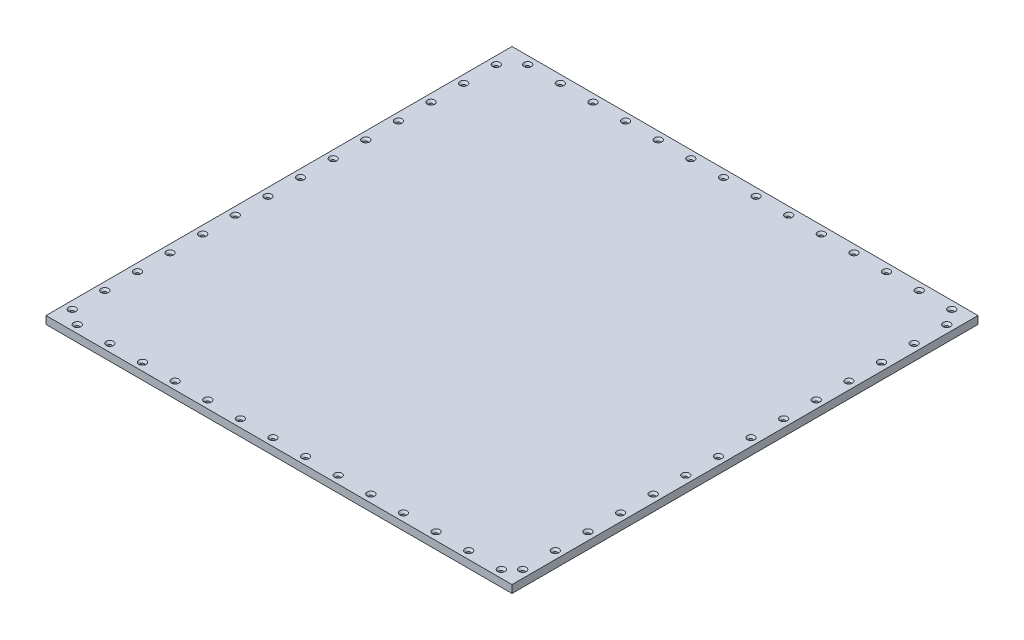
from build123d import *

# Parameters (mm, degrees)
SKETCH1_W                                       = 600
SKETCH1_H                                       = 600
BOSS_EXTRUDE1_DEPTH                             = 10
CSK_FOR_M4_FLAT_HEAD_MACHINE_SCREW1_D           = 4.3
CSK_FOR_M4_FLAT_HEAD_MACHINE_SCREW1_CSINK_D     = 9.4
CSK_FOR_M4_FLAT_HEAD_MACHINE_SCREW1_CSINK_ANGLE = 90


with BuildPart() as part:
    # Sketch1 → Boss-Extrude1 (new body)
    with BuildSketch(Plane(origin=(0, 0, 0), x_dir=(1, 0, 0), z_dir=(0, 1, 0))):
        with Locations((300, 300)):
            Rectangle(SKETCH1_W, SKETCH1_H)
    extrude(amount=BOSS_EXTRUDE1_DEPTH)

    # CSK for M4 Flat Head Machine Screw1 (through all)
    with Locations(Plane(origin=(0, 10, 0), x_dir=(1, 0, 0), z_dir=(0, 1, 0))):
        with Locations((10, 569.75), (30.25, 590), (72.25, 590), (114.25, 590), (156.25, 590), (198.25, 590), (240.25, 590), (282.25, 590), (324.25, 590), (366.25, 590), (408.25, 590), (450.25, 590), (492.25, 590), (534.25, 590), (576.25, 590), (72.25, 10), (114.25, 10), (156.25, 10), (198.25, 10), (240.25, 10), (282.25, 10), (324.25, 10), (366.25, 10), (408.25, 10), (450.25, 10), (492.25, 10), (534.25, 10), (576.25, 10), (30.25, 10), (590, 569.75), (590, 527.75), (590, 485.75), (590, 443.75), (590, 401.75), (590, 359.75), (590, 317.75), (590, 275.75), (590, 233.75), (590, 191.75), (590, 149.75), (590, 107.75), (590, 65.75), (590, 23.75), (10, 527.75), (10, 485.75), (10, 443.75), (10, 401.75), (10, 359.75), (10, 317.75), (10, 275.75), (10, 233.75), (10, 191.75), (10, 149.75), (10, 107.75), (10, 65.75), (10, 23.75)):
            CounterSinkHole(CSK_FOR_M4_FLAT_HEAD_MACHINE_SCREW1_D / 2, CSK_FOR_M4_FLAT_HEAD_MACHINE_SCREW1_CSINK_D / 2, counter_sink_angle=CSK_FOR_M4_FLAT_HEAD_MACHINE_SCREW1_CSINK_ANGLE)


solid = part.part
